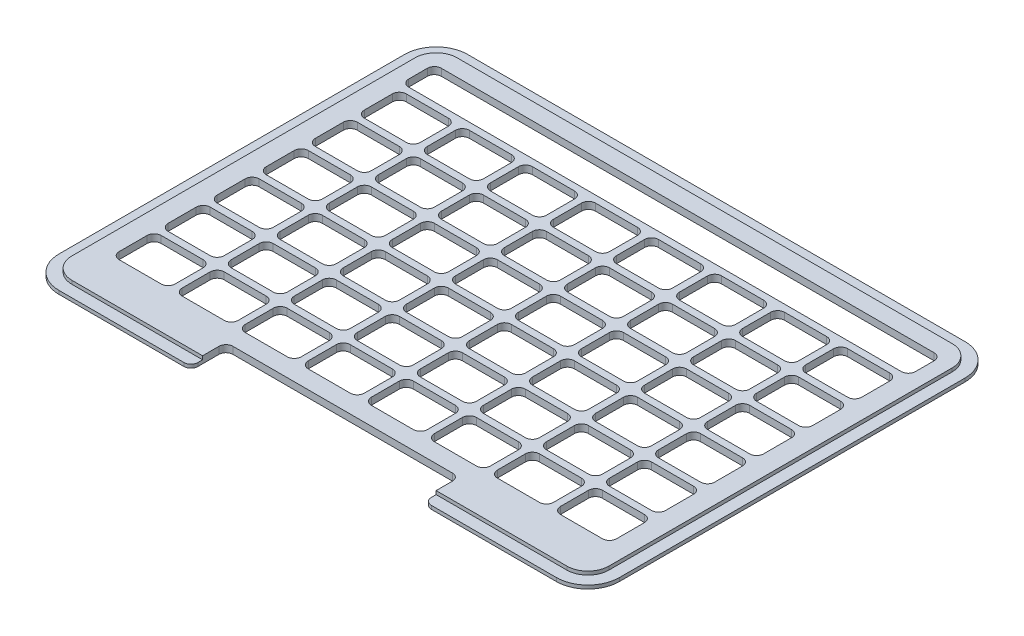
from build123d import *

# Parameters (mm, degrees)
SKETCH1_W                = 240
SKETCH1_H                = 175
OUTER_PROFILE_DEPTH      = 1.5
SKETCH2_W                = 230
SKETCH2_H                = 165
INNER_PROFILE_DEPTH      = 1.5
FILLET1_R                = 9
FILLET2_R                = 13.5
SKETCH3_W                = 24
SKETCH3_H                = 18
CUTOUT_DEPTH             = 149.543764595
CORNERS_R                = 3
CUTOUTS_COUNT            = 4
CUTOUTS_PITCH            = 27
CUTOUTS_COUNT_DIR2       = 6
CUTOUTS_PITCH_DIR2       = 21
CORNERS_OF_CUTOUTS_R     = 3
MIRROR1_DEPTH            = 3
SKETCH4_W                = 217
SKETCH4_H                = 14
MESSAGE_WINDOW_DEPTH     = 149.543764595
MESSAGE_WINDOW_CORNERS_R = 3
SKETCH6_W                = 100
SKETCH6_H                = 15
BASE_CUTBACK_DEPTH       = 149.543764595
FILLET5_R                = 3


# Read off the part's stored shape, not the designer's step: Mirror1
with BuildPart() as part:
    # Sketch1 → Outer Profile (new body)
    with BuildSketch(Plane(origin=(0, 0, 0), x_dir=(1, 0, 0), z_dir=(0, 1, 0))):
        Rectangle(SKETCH1_W, SKETCH1_H)
    extrude(amount=OUTER_PROFILE_DEPTH)

    # Sketch2 → Inner Profile (add)
    with BuildSketch(Plane(origin=(0, 1.5, 0), x_dir=(1, 0, 0), z_dir=(0, 1, 0))):
        Rectangle(SKETCH2_W, SKETCH2_H)
    extrude(amount=INNER_PROFILE_DEPTH)

    # Fillet1
    fillet1_edges = [part.edges().sort_by_distance(p)[0] for p in [
        (115, 2.25, 82.5),
        (115, 2.25, -82.5),
        (-115, 2.25, -82.5),
        (-115, 2.25, 82.5),
    ]]
    fillet(fillet1_edges, radius=FILLET1_R)

    # Fillet2
    fillet2_edges = [part.edges().sort_by_distance(p)[0] for p in [
        (120, 0.75, 87.5),
        (-120, 0.75, 87.5),
        (-120, 0.75, -87.5),
        (120, 0.75, -87.5),
    ]]
    fillet(fillet2_edges, radius=FILLET2_R)

    # Sketch3 → Cutout (cut, through all)
    with BuildSketch(Plane(origin=(0, 3, 0), x_dir=(1, 0, 0), z_dir=(0, 1, 0))):
        with Locations((-13.5, -55.75)):
            Rectangle(SKETCH3_W, SKETCH3_H)
    cutout = extrude(amount=-CUTOUT_DEPTH, mode=Mode.SUBTRACT)

    # Corners
    corners_edges = [part.edges().sort_by_distance(p)[0] for p in [
        (-1.5, 1.5, 46.75),
        (-1.5, 1.5, 64.75),
        (-25.5, 1.5, 64.75),
        (-25.5, 1.5, 46.75),
    ]]
    fillet(corners_edges, radius=CORNERS_R)

    # Cutouts: Cutout 4 × 6
    with Locations(*[(-i * CUTOUTS_PITCH, 0, -j * CUTOUTS_PITCH_DIR2) for i in range(CUTOUTS_COUNT) for j in range(CUTOUTS_COUNT_DIR2) if (i, j) != (0, 0)]):
        add(cutout, mode=Mode.SUBTRACT)

    # Corners of Cutouts
    corners_of_cutouts_edges = [part.edges().sort_by_distance(p)[0] for p in [
        (-1.5, 1.5, 25.75),
        (-1.5, 1.5, 43.75),
        (-25.5, 1.5, 43.75),
        (-25.5, 1.5, 25.75),
        (-1.5, 1.5, 4.75),
        (-1.5, 1.5, 22.75),
        (-25.5, 1.5, 22.75),
        (-25.5, 1.5, 4.75),
        (-1.5, 1.5, -16.25),
        (-1.5, 1.5, 1.75),
        (-25.5, 1.5, 1.75),
        (-25.5, 1.5, -16.25),
        (-1.5, 1.5, -37.25),
        (-1.5, 1.5, -19.25),
        (-25.5, 1.5, -19.25),
        (-25.5, 1.5, -37.25),
        (-1.5, 1.5, -58.25),
        (-1.5, 1.5, -40.25),
        (-25.5, 1.5, -40.25),
        (-25.5, 1.5, -58.25),
        (-28.5, 1.5, 46.75),
        (-28.5, 1.5, 64.75),
        (-52.5, 1.5, 64.75),
        (-52.5, 1.5, 46.75),
        (-28.5, 1.5, 25.75),
        (-28.5, 1.5, 43.75),
        (-52.5, 1.5, 43.75),
        (-52.5, 1.5, 25.75),
        (-28.5, 1.5, 4.75),
        (-28.5, 1.5, 22.75),
        (-52.5, 1.5, 22.75),
        (-52.5, 1.5, 4.75),
        (-28.5, 1.5, -16.25),
        (-28.5, 1.5, 1.75),
        (-52.5, 1.5, 1.75),
        (-52.5, 1.5, -16.25),
        (-28.5, 1.5, -37.25),
        (-28.5, 1.5, -19.25),
        (-52.5, 1.5, -19.25),
        (-52.5, 1.5, -37.25),
        (-28.5, 1.5, -58.25),
        (-28.5, 1.5, -40.25),
        (-52.5, 1.5, -40.25),
        (-52.5, 1.5, -58.25),
        (-55.5, 1.5, 46.75),
        (-55.5, 1.5, 64.75),
        (-79.5, 1.5, 64.75),
        (-79.5, 1.5, 46.75),
        (-55.5, 1.5, 25.75),
        (-55.5, 1.5, 43.75),
        (-79.5, 1.5, 43.75),
        (-79.5, 1.5, 25.75),
        (-55.5, 1.5, 4.75),
        (-55.5, 1.5, 22.75),
        (-79.5, 1.5, 22.75),
        (-79.5, 1.5, 4.75),
        (-55.5, 1.5, -16.25),
        (-55.5, 1.5, 1.75),
        (-79.5, 1.5, 1.75),
        (-79.5, 1.5, -16.25),
        (-55.5, 1.5, -37.25),
        (-55.5, 1.5, -19.25),
        (-79.5, 1.5, -19.25),
        (-79.5, 1.5, -37.25),
        (-55.5, 1.5, -58.25),
        (-55.5, 1.5, -40.25),
        (-79.5, 1.5, -40.25),
        (-79.5, 1.5, -58.25),
        (-82.5, 1.5, 46.75),
        (-82.5, 1.5, 64.75),
        (-106.5, 1.5, 64.75),
        (-106.5, 1.5, 46.75),
        (-82.5, 1.5, 25.75),
        (-82.5, 1.5, 43.75),
        (-106.5, 1.5, 43.75),
        (-106.5, 1.5, 25.75),
        (-82.5, 1.5, 4.75),
        (-82.5, 1.5, 22.75),
        (-106.5, 1.5, 22.75),
        (-106.5, 1.5, 4.75),
        (-82.5, 1.5, -16.25),
        (-82.5, 1.5, 1.75),
        (-106.5, 1.5, 1.75),
        (-106.5, 1.5, -16.25),
        (-82.5, 1.5, -37.25),
        (-82.5, 1.5, -19.25),
        (-106.5, 1.5, -19.25),
        (-106.5, 1.5, -37.25),
        (-82.5, 1.5, -58.25),
        (-82.5, 1.5, -40.25),
        (-106.5, 1.5, -40.25),
        (-106.5, 1.5, -58.25),
    ]]
    fillet(corners_of_cutouts_edges, radius=CORNERS_OF_CUTOUTS_R)

    # Mirror1 outline → Mirror1 (cut)
    with BuildSketch(Plane(origin=(0, 0, 0), x_dir=(1, 0, 0), z_dir=(0, 1, 0))):
        with BuildLine():
            Line((4.5, -64.75), (22.5, -64.75))
            ThreePointArc((22.5, -64.75), (24.621320344, -63.871320344), (25.5, -61.75))
            Line((25.5, -61.75), (25.5, -49.75))
            ThreePointArc((25.5, -49.75), (24.621320344, -47.628679656), (22.5, -46.75))
            Line((22.5, -46.75), (4.5, -46.75))
            ThreePointArc((4.5, -46.75), (2.378679656, -47.628679656), (1.5, -49.75))
            Line((1.5, -49.75), (1.5, -61.75))
            ThreePointArc((1.5, -61.75), (2.378679656, -63.871320344), (4.5, -64.75))
        make_face()
        with BuildLine():
            Line((31.5, -64.75), (49.5, -64.75))
            ThreePointArc((49.5, -64.75), (51.621320344, -63.871320344), (52.5, -61.75))
            Line((52.5, -61.75), (52.5, -49.75))
            ThreePointArc((52.5, -49.75), (51.621320344, -47.628679656), (49.5, -46.75))
            Line((49.5, -46.75), (31.5, -46.75))
            ThreePointArc((31.5, -46.75), (29.378679656, -47.628679656), (28.5, -49.75))
            Line((28.5, -49.75), (28.5, -61.75))
            ThreePointArc((28.5, -61.75), (29.378679656, -63.871320344), (31.5, -64.75))
        make_face()
        with BuildLine():
            Line((58.5, -64.75), (76.5, -64.75))
            ThreePointArc((76.5, -64.75), (78.621320344, -63.871320344), (79.5, -61.75))
            Line((79.5, -61.75), (79.5, -49.75))
            ThreePointArc((79.5, -49.75), (78.621320344, -47.628679656), (76.5, -46.75))
            Line((76.5, -46.75), (58.5, -46.75))
            ThreePointArc((58.5, -46.75), (56.378679656, -47.628679656), (55.5, -49.75))
            Line((55.5, -49.75), (55.5, -61.75))
            ThreePointArc((55.5, -61.75), (56.378679656, -63.871320344), (58.5, -64.75))
        make_face()
        with BuildLine():
            Line((85.5, -64.75), (103.5, -64.75))
            ThreePointArc((103.5, -64.75), (105.621320344, -63.871320344), (106.5, -61.75))
            Line((106.5, -61.75), (106.5, -49.75))
            ThreePointArc((106.5, -49.75), (105.621320344, -47.628679656), (103.5, -46.75))
            Line((103.5, -46.75), (85.5, -46.75))
            ThreePointArc((85.5, -46.75), (83.378679656, -47.628679656), (82.5, -49.75))
            Line((82.5, -49.75), (82.5, -61.75))
            ThreePointArc((82.5, -61.75), (83.378679656, -63.871320344), (85.5, -64.75))
        make_face()
        with BuildLine():
            Line((4.5, -43.75), (22.5, -43.75))
            ThreePointArc((22.5, -43.75), (24.621320344, -42.871320344), (25.5, -40.75))
            Line((25.5, -40.75), (25.5, -28.75))
            ThreePointArc((25.5, -28.75), (24.621320344, -26.628679656), (22.5, -25.75))
            Line((22.5, -25.75), (4.5, -25.75))
            ThreePointArc((4.5, -25.75), (2.378679656, -26.628679656), (1.5, -28.75))
            Line((1.5, -28.75), (1.5, -40.75))
            ThreePointArc((1.5, -40.75), (2.378679656, -42.871320344), (4.5, -43.75))
        make_face()
        with BuildLine():
            Line((31.5, -43.75), (49.5, -43.75))
            ThreePointArc((49.5, -43.75), (51.621320344, -42.871320344), (52.5, -40.75))
            Line((52.5, -40.75), (52.5, -28.75))
            ThreePointArc((52.5, -28.75), (51.621320344, -26.628679656), (49.5, -25.75))
            Line((49.5, -25.75), (31.5, -25.75))
            ThreePointArc((31.5, -25.75), (29.378679656, -26.628679656), (28.5, -28.75))
            Line((28.5, -28.75), (28.5, -40.75))
            ThreePointArc((28.5, -40.75), (29.378679656, -42.871320344), (31.5, -43.75))
        make_face()
        with BuildLine():
            Line((58.5, -43.75), (76.5, -43.75))
            ThreePointArc((76.5, -43.75), (78.621320344, -42.871320344), (79.5, -40.75))
            Line((79.5, -40.75), (79.5, -28.75))
            ThreePointArc((79.5, -28.75), (78.621320344, -26.628679656), (76.5, -25.75))
            Line((76.5, -25.75), (58.5, -25.75))
            ThreePointArc((58.5, -25.75), (56.378679656, -26.628679656), (55.5, -28.75))
            Line((55.5, -28.75), (55.5, -40.75))
            ThreePointArc((55.5, -40.75), (56.378679656, -42.871320344), (58.5, -43.75))
        make_face()
        with BuildLine():
            Line((85.5, -43.75), (103.5, -43.75))
            ThreePointArc((103.5, -43.75), (105.621320344, -42.871320344), (106.5, -40.75))
            Line((106.5, -40.75), (106.5, -28.75))
            ThreePointArc((106.5, -28.75), (105.621320344, -26.628679656), (103.5, -25.75))
            Line((103.5, -25.75), (85.5, -25.75))
            ThreePointArc((85.5, -25.75), (83.378679656, -26.628679656), (82.5, -28.75))
            Line((82.5, -28.75), (82.5, -40.75))
            ThreePointArc((82.5, -40.75), (83.378679656, -42.871320344), (85.5, -43.75))
        make_face()
        with BuildLine():
            Line((4.5, -22.75), (22.5, -22.75))
            ThreePointArc((22.5, -22.75), (24.621320344, -21.871320344), (25.5, -19.75))
            Line((25.5, -19.75), (25.5, -7.75))
            ThreePointArc((25.5, -7.75), (24.621320344, -5.628679656), (22.5, -4.75))
            Line((22.5, -4.75), (4.5, -4.75))
            ThreePointArc((4.5, -4.75), (2.378679656, -5.628679656), (1.5, -7.75))
            Line((1.5, -7.75), (1.5, -19.75))
            ThreePointArc((1.5, -19.75), (2.378679656, -21.871320344), (4.5, -22.75))
        make_face()
        with BuildLine():
            Line((31.5, -22.75), (49.5, -22.75))
            ThreePointArc((49.5, -22.75), (51.621320344, -21.871320344), (52.5, -19.75))
            Line((52.5, -19.75), (52.5, -7.75))
            ThreePointArc((52.5, -7.75), (51.621320344, -5.628679656), (49.5, -4.75))
            Line((49.5, -4.75), (31.5, -4.75))
            ThreePointArc((31.5, -4.75), (29.378679656, -5.628679656), (28.5, -7.75))
            Line((28.5, -7.75), (28.5, -19.75))
            ThreePointArc((28.5, -19.75), (29.378679656, -21.871320344), (31.5, -22.75))
        make_face()
        with BuildLine():
            Line((58.5, -22.75), (76.5, -22.75))
            ThreePointArc((76.5, -22.75), (78.621320344, -21.871320344), (79.5, -19.75))
            Line((79.5, -19.75), (79.5, -7.75))
            ThreePointArc((79.5, -7.75), (78.621320344, -5.628679656), (76.5, -4.75))
            Line((76.5, -4.75), (58.5, -4.75))
            ThreePointArc((58.5, -4.75), (56.378679656, -5.628679656), (55.5, -7.75))
            Line((55.5, -7.75), (55.5, -19.75))
            ThreePointArc((55.5, -19.75), (56.378679656, -21.871320344), (58.5, -22.75))
        make_face()
        with BuildLine():
            Line((85.5, -22.75), (103.5, -22.75))
            ThreePointArc((103.5, -22.75), (105.621320344, -21.871320344), (106.5, -19.75))
            Line((106.5, -19.75), (106.5, -7.75))
            ThreePointArc((106.5, -7.75), (105.621320344, -5.628679656), (103.5, -4.75))
            Line((103.5, -4.75), (85.5, -4.75))
            ThreePointArc((85.5, -4.75), (83.378679656, -5.628679656), (82.5, -7.75))
            Line((82.5, -7.75), (82.5, -19.75))
            ThreePointArc((82.5, -19.75), (83.378679656, -21.871320344), (85.5, -22.75))
        make_face()
        with BuildLine():
            Line((4.5, -1.75), (22.5, -1.75))
            ThreePointArc((22.5, -1.75), (24.621320344, -0.871320344), (25.5, 1.25))
            Line((25.5, 1.25), (25.5, 13.25))
            ThreePointArc((25.5, 13.25), (24.621320344, 15.371320344), (22.5, 16.25))
            Line((22.5, 16.25), (4.5, 16.25))
            ThreePointArc((4.5, 16.25), (2.378679656, 15.371320344), (1.5, 13.25))
            Line((1.5, 13.25), (1.5, 1.25))
            ThreePointArc((1.5, 1.25), (2.378679656, -0.871320344), (4.5, -1.75))
        make_face()
        with BuildLine():
            Line((31.5, -1.75), (49.5, -1.75))
            ThreePointArc((49.5, -1.75), (51.621320344, -0.871320344), (52.5, 1.25))
            Line((52.5, 1.25), (52.5, 13.25))
            ThreePointArc((52.5, 13.25), (51.621320344, 15.371320344), (49.5, 16.25))
            Line((49.5, 16.25), (31.5, 16.25))
            ThreePointArc((31.5, 16.25), (29.378679656, 15.371320344), (28.5, 13.25))
            Line((28.5, 13.25), (28.5, 1.25))
            ThreePointArc((28.5, 1.25), (29.378679656, -0.871320344), (31.5, -1.75))
        make_face()
        with BuildLine():
            Line((58.5, -1.75), (76.5, -1.75))
            ThreePointArc((76.5, -1.75), (78.621320344, -0.871320344), (79.5, 1.25))
            Line((79.5, 1.25), (79.5, 13.25))
            ThreePointArc((79.5, 13.25), (78.621320344, 15.371320344), (76.5, 16.25))
            Line((76.5, 16.25), (58.5, 16.25))
            ThreePointArc((58.5, 16.25), (56.378679656, 15.371320344), (55.5, 13.25))
            Line((55.5, 13.25), (55.5, 1.25))
            ThreePointArc((55.5, 1.25), (56.378679656, -0.871320344), (58.5, -1.75))
        make_face()
        with BuildLine():
            Line((85.5, -1.75), (103.5, -1.75))
            ThreePointArc((103.5, -1.75), (105.621320344, -0.871320344), (106.5, 1.25))
            Line((106.5, 1.25), (106.5, 13.25))
            ThreePointArc((106.5, 13.25), (105.621320344, 15.371320344), (103.5, 16.25))
            Line((103.5, 16.25), (85.5, 16.25))
            ThreePointArc((85.5, 16.25), (83.378679656, 15.371320344), (82.5, 13.25))
            Line((82.5, 13.25), (82.5, 1.25))
            ThreePointArc((82.5, 1.25), (83.378679656, -0.871320344), (85.5, -1.75))
        make_face()
        with BuildLine():
            Line((4.5, 19.25), (22.5, 19.25))
            ThreePointArc((22.5, 19.25), (24.621320344, 20.128679656), (25.5, 22.25))
            Line((25.5, 22.25), (25.5, 34.25))
            ThreePointArc((25.5, 34.25), (24.621320344, 36.371320344), (22.5, 37.25))
            Line((22.5, 37.25), (4.5, 37.25))
            ThreePointArc((4.5, 37.25), (2.378679656, 36.371320344), (1.5, 34.25))
            Line((1.5, 34.25), (1.5, 22.25))
            ThreePointArc((1.5, 22.25), (2.378679656, 20.128679656), (4.5, 19.25))
        make_face()
        with BuildLine():
            Line((31.5, 19.25), (49.5, 19.25))
            ThreePointArc((49.5, 19.25), (51.621320344, 20.128679656), (52.5, 22.25))
            Line((52.5, 22.25), (52.5, 34.25))
            ThreePointArc((52.5, 34.25), (51.621320344, 36.371320344), (49.5, 37.25))
            Line((49.5, 37.25), (31.5, 37.25))
            ThreePointArc((31.5, 37.25), (29.378679656, 36.371320344), (28.5, 34.25))
            Line((28.5, 34.25), (28.5, 22.25))
            ThreePointArc((28.5, 22.25), (29.378679656, 20.128679656), (31.5, 19.25))
        make_face()
        with BuildLine():
            Line((58.5, 19.25), (76.5, 19.25))
            ThreePointArc((76.5, 19.25), (78.621320344, 20.128679656), (79.5, 22.25))
            Line((79.5, 22.25), (79.5, 34.25))
            ThreePointArc((79.5, 34.25), (78.621320344, 36.371320344), (76.5, 37.25))
            Line((76.5, 37.25), (58.5, 37.25))
            ThreePointArc((58.5, 37.25), (56.378679656, 36.371320344), (55.5, 34.25))
            Line((55.5, 34.25), (55.5, 22.25))
            ThreePointArc((55.5, 22.25), (56.378679656, 20.128679656), (58.5, 19.25))
        make_face()
        with BuildLine():
            Line((85.5, 19.25), (103.5, 19.25))
            ThreePointArc((103.5, 19.25), (105.621320344, 20.128679656), (106.5, 22.25))
            Line((106.5, 22.25), (106.5, 34.25))
            ThreePointArc((106.5, 34.25), (105.621320344, 36.371320344), (103.5, 37.25))
            Line((103.5, 37.25), (85.5, 37.25))
            ThreePointArc((85.5, 37.25), (83.378679656, 36.371320344), (82.5, 34.25))
            Line((82.5, 34.25), (82.5, 22.25))
            ThreePointArc((82.5, 22.25), (83.378679656, 20.128679656), (85.5, 19.25))
        make_face()
        with BuildLine():
            Line((4.5, 40.25), (22.5, 40.25))
            ThreePointArc((22.5, 40.25), (24.621320344, 41.128679656), (25.5, 43.25))
            Line((25.5, 43.25), (25.5, 55.25))
            ThreePointArc((25.5, 55.25), (24.621320344, 57.371320344), (22.5, 58.25))
            Line((22.5, 58.25), (4.5, 58.25))
            ThreePointArc((4.5, 58.25), (2.378679656, 57.371320344), (1.5, 55.25))
            Line((1.5, 55.25), (1.5, 43.25))
            ThreePointArc((1.5, 43.25), (2.378679656, 41.128679656), (4.5, 40.25))
        make_face()
        with BuildLine():
            Line((31.5, 40.25), (49.5, 40.25))
            ThreePointArc((49.5, 40.25), (51.621320344, 41.128679656), (52.5, 43.25))
            Line((52.5, 43.25), (52.5, 55.25))
            ThreePointArc((52.5, 55.25), (51.621320344, 57.371320344), (49.5, 58.25))
            Line((49.5, 58.25), (31.5, 58.25))
            ThreePointArc((31.5, 58.25), (29.378679656, 57.371320344), (28.5, 55.25))
            Line((28.5, 55.25), (28.5, 43.25))
            ThreePointArc((28.5, 43.25), (29.378679656, 41.128679656), (31.5, 40.25))
        make_face()
        with BuildLine():
            Line((58.5, 40.25), (76.5, 40.25))
            ThreePointArc((76.5, 40.25), (78.621320344, 41.128679656), (79.5, 43.25))
            Line((79.5, 43.25), (79.5, 55.25))
            ThreePointArc((79.5, 55.25), (78.621320344, 57.371320344), (76.5, 58.25))
            Line((76.5, 58.25), (58.5, 58.25))
            ThreePointArc((58.5, 58.25), (56.378679656, 57.371320344), (55.5, 55.25))
            Line((55.5, 55.25), (55.5, 43.25))
            ThreePointArc((55.5, 43.25), (56.378679656, 41.128679656), (58.5, 40.25))
        make_face()
        with BuildLine():
            Line((85.5, 40.25), (103.5, 40.25))
            ThreePointArc((103.5, 40.25), (105.621320344, 41.128679656), (106.5, 43.25))
            Line((106.5, 43.25), (106.5, 55.25))
            ThreePointArc((106.5, 55.25), (105.621320344, 57.371320344), (103.5, 58.25))
            Line((103.5, 58.25), (85.5, 58.25))
            ThreePointArc((85.5, 58.25), (83.378679656, 57.371320344), (82.5, 55.25))
            Line((82.5, 55.25), (82.5, 43.25))
            ThreePointArc((82.5, 43.25), (83.378679656, 41.128679656), (85.5, 40.25))
        make_face()
    extrude(amount=MIRROR1_DEPTH, mode=Mode.SUBTRACT)

    # Sketch4 → Message Window (cut, through all)
    with BuildSketch(Plane(origin=(0, 3, 0), x_dir=(1, 0, 0), z_dir=(0, 1, 0))):
        with Locations((0, 68.25)):
            Rectangle(SKETCH4_W, SKETCH4_H)
    extrude(amount=-MESSAGE_WINDOW_DEPTH, mode=Mode.SUBTRACT)

    # Message Window Corners
    message_window_corners_edges = [part.edges().sort_by_distance(p)[0] for p in [
        (-108.5, 1.5, -61.25),
        (-108.5, 1.5, -75.25),
        (108.5, 1.5, -75.25),
        (108.5, 1.5, -61.25),
    ]]
    fillet(message_window_corners_edges, radius=MESSAGE_WINDOW_CORNERS_R)

    # Sketch6 → Base Cutback (cut, through all)
    with BuildSketch(Plane(origin=(0, 3, 0), x_dir=(1, 0, 0), z_dir=(0, 1, 0))):
        with Locations((0, -80)):
            Rectangle(SKETCH6_W, SKETCH6_H)
    extrude(amount=-BASE_CUTBACK_DEPTH, mode=Mode.SUBTRACT)

    # Fillet5
    fillet5_edges = [part.edges().sort_by_distance(p)[0] for p in [
        (50, 0.75, 87.5),
        (50, 1.5, 72.5),
        (-50, 0.75, 87.5),
        (-50, 1.5, 72.5),
    ]]
    fillet(fillet5_edges, radius=FILLET5_R)


solid = part.part
